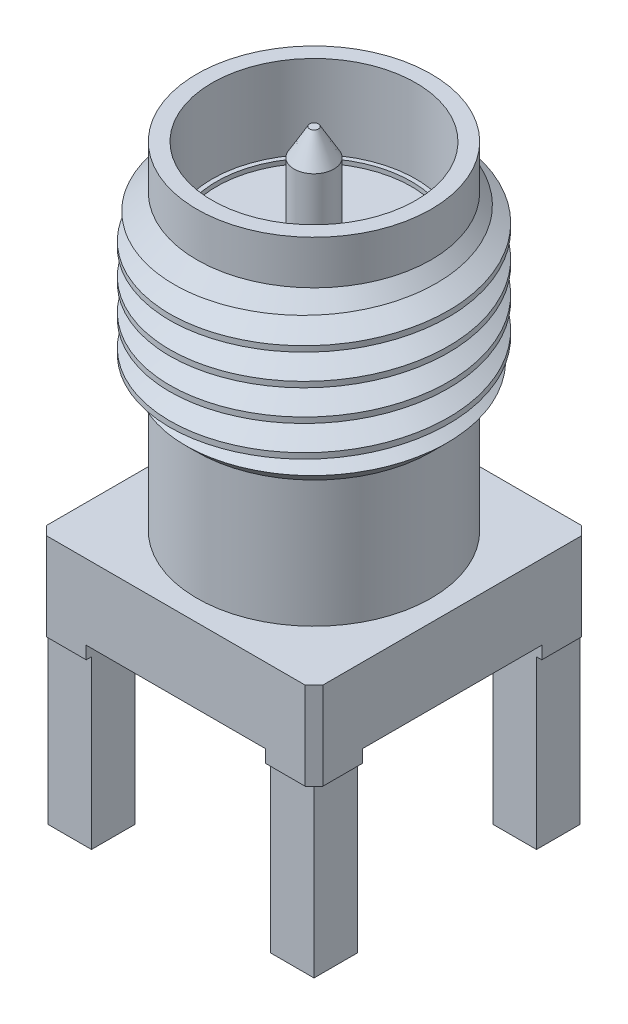
from build123d import *

# Parameters (mm, degrees)
EXTRUDE_1_DEPTH     = 2
SKETCH_3_W          = 0.989949494
SKETCH_3_H          = 0.989949494
EXTRUDE_2_DEPTH     = 3.81
CUT_EXTRUDE_START   = -0.29
SKETCH_8_R          = 0.635
CUT_EXTRUDE_2_DEPTH = 0.29
CUT_EXTRUDE_START_2 = -0.1
SKETCH_4_R          = 2.5
SKETCH_4_R_2        = 0.635
CUT_EXTRUDE_1_DEPTH = 0.1
SWEEP_1_PITCH       = 0.705


with BuildPart() as part:
    # Эскиз1 → Повернуть1 (revolve)
    with BuildSketch(Plane.XY, mode=Mode.PRIVATE) as revolve_1_sk:
        Polygon((-2.675, 5.81), (-2.675, 8.7), (-3.175, 9.2), (-3.175, 12), (-2.675, 12.5), (-2.675, 13.5), (-2.325, 13.5), (-2.325, 11.6), (-2.225, 11.6), (-2.225, 11.5), (-0.455, 11.5), (-0.455, 13.185121963), (-0.1, 13.8), (0, 13.8), (0, 6.9), (0, 0), (-0.635, 0), (-0.635, 5.81), align=None)
    revolve(revolve_1_sk.sketch.rotate(Axis((0, -1000, 0), (0, 1, 0)), 180), axis=Axis((0, -1000, 0), (0, 1, 0)))

    # Эскиз2 → Бобышка-Вытянуть1 (add)
    with BuildSketch(Plane.XZ.offset(-5.81)):
        Polygon((2.955, -3.155), (3.155, -2.955), (3.155, 2.955), (2.955, 3.155), (-2.955, 3.155), (-3.155, 2.955), (-3.155, -2.955), (-2.955, -3.155), align=None)
    extrude(amount=EXTRUDE_1_DEPTH)

    # Эскиз3 → Бобышка-Вытянуть2 (add)
    with BuildSketch(Plane.XZ.offset(-3.81)):
        with Locations((-2.54, 2.54)):
            Rectangle(SKETCH_3_W, SKETCH_3_H)
        with Locations((-2.54, -2.54)):
            Rectangle(SKETCH_3_W, SKETCH_3_H)
        with Locations((2.54, -2.54)):
            Rectangle(SKETCH_3_W, SKETCH_3_H)
        with Locations((2.54, 2.54)):
            Rectangle(SKETCH_3_W, SKETCH_3_H)
    extrude(amount=EXTRUDE_2_DEPTH)

    # Эскиз8 → Вырез-Вытянуть2 (cut)
    with BuildSketch(Plane.XZ.offset(-3.81).offset(CUT_EXTRUDE_START)):
        Polygon((-2.045025253, -2.045025253), (-2.045025253, -3.155), (2.045025253, -3.155), (2.045025253, -2.045025253), (3.155, -2.045025253), (3.155, 2.045025253), (2.045025253, 2.045025253), (2.045025253, 3.155), (-2.045025253, 3.155), (-2.045025253, 2.045025253), (-3.155, 2.045025253), (-3.155, -2.045025253), align=None)
        Circle(SKETCH_8_R, mode=Mode.SUBTRACT)
    extrude(amount=CUT_EXTRUDE_2_DEPTH, mode=Mode.SUBTRACT)

    # Эскиз4 → Вырез-Вытянуть1 (cut)
    with BuildSketch(Plane.XZ.offset(-4.1).offset(CUT_EXTRUDE_START_2)):
        Circle(SKETCH_4_R)
        Circle(SKETCH_4_R_2, mode=Mode.SUBTRACT)
    extrude(amount=CUT_EXTRUDE_1_DEPTH, mode=Mode.SUBTRACT)

    # Вырез-По траектории1: the profile of Эскиз6 screwed along a right-hand helix of 7 turns, 6 arcs to a turn; built about Z, then put on its axis
    sweep_1_z = Axis((0, 0, 0), (0, 0, 1))
    sweep_1_corners = [(2.675, 0, 0), (3.675, 0, 0.577350269), (3.675, 0, -0.577350269)]
    with BuildLine(mode=Mode.PRIVATE) as sweep_1_profile:
        Line(sweep_1_corners[0], sweep_1_corners[1])
        Line(sweep_1_corners[1], sweep_1_corners[2])
        Line(sweep_1_corners[2], sweep_1_corners[0])
    sweep_1_cap = Face(sweep_1_profile.wire())
    sweep_1_turn_angles = [0, 30, 60, 90, 120, 150, 180, 210, 240, 270, 300, 330, 360]
    sweep_1_turn_weights = [1, 0.8660254037844387, 1, 0.8660254037844387, 1, 0.8660254037844387, 1, 0.8660254037844387, 1, 0.8660254037844387, 1, 0.8660254037844387, 1]
    sweep_1_turn_rails = [Edge.make_bspline([Vector(p[0], p[1], 0).rotate(sweep_1_z, sweep_1_turn_angles[k]) / sweep_1_turn_weights[k] + Vector(0, 0, p[2] + SWEEP_1_PITCH * sweep_1_turn_angles[k] / 360) for k in range(13)], [0, 0, 0, 1, 1, 2, 2, 3, 3, 4, 4, 5, 5, 6, 6, 6], 2, sweep_1_turn_weights) for p in sweep_1_corners]
    sweep_1_turn_sides = [Face.make_surface_from_curves(sweep_1_turn_rails[p[0]], sweep_1_turn_rails[p[1]]) for p in [(0, 1), (1, 2), (2, 0)]]
    sweep_1 = Plane(origin=(0, 13.5, 0), x_dir=(1, 0, 0), z_dir=(0, -1, 0)) * Solid(Shell([*[p.moved(Location((0, 0, SWEEP_1_PITCH * i))) for i in range(7) for p in sweep_1_turn_sides], sweep_1_cap, sweep_1_cap.rotate(sweep_1_z, 2520).moved(Location((0, 0, SWEEP_1_PITCH * 2520 / 360)))]))
    add(sweep_1, mode=Mode.SUBTRACT)


solid = part.part
